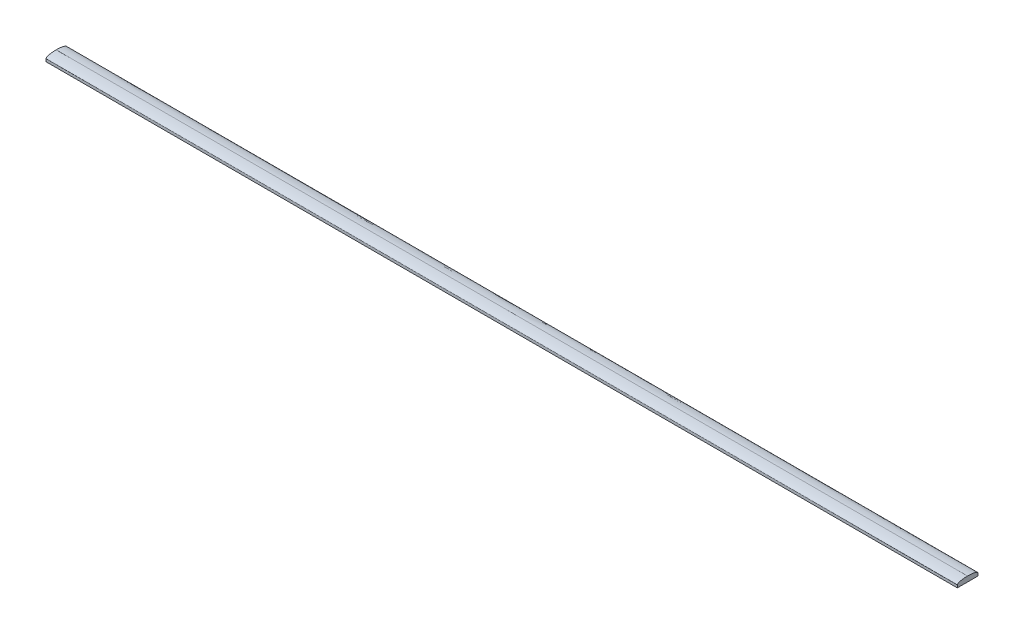
from build123d import *

# Parameters (mm, degrees)
SKETCH1_W           = 441.198
SKETCH1_H           = 10
BOSS_EXTRUDE1_DEPTH = 2.54
FILLET5_SIZE        = 1.27
FILLET5_SIZE_2      = 5.08


with BuildPart() as part:
    # Sketch1 → Boss-Extrude1 (new body)
    with BuildSketch(Plane(origin=(0, 0, 0), x_dir=(1, 0, 0), z_dir=(0, 1, 0))):
        with Locations((220.599, 5)):
            Rectangle(SKETCH1_W, SKETCH1_H)
    extrude(amount=BOSS_EXTRUDE1_DEPTH)

    # Fillet5
    # an asymmetric fillet: 5.08, 1.27 mm, written as the material it takes off along each edge
    with BuildSketch(Plane(origin=(453.898, 2.54, -10), x_dir=(0, -1, 0), z_dir=(-1, 0, 0)), Plane(origin=(-12.7, 2.54, 0), x_dir=(0, -1, 0), z_dir=(1, 0, 0))) as fillet5_piece_1:
        with BuildLine():
            Bezier((FILLET5_SIZE, 0), (0, 0), (0, FILLET5_SIZE_2), weights=[1, 0.707106781, 1])
            Line((0, FILLET5_SIZE_2), (0, 0))
            Line((0, 0), (FILLET5_SIZE, 0))
        make_face()
    extrude(amount=466.598, mode=Mode.SUBTRACT)


solid = part.part
